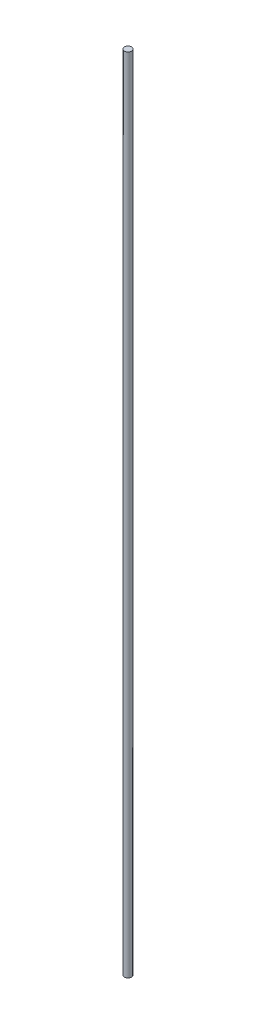
from build123d import *

# Parameters (mm, degrees)
SKETCH1_R           = 1.397
BOSS_EXTRUDE1_DEPTH = 304.8


with BuildPart() as part:
    # Sketch1 → Boss-Extrude1 (new body)
    with BuildSketch(Plane(origin=(0, 0, 0), x_dir=(1, 0, 0), z_dir=(0, 1, 0))):
        Circle(SKETCH1_R)
    extrude(amount=BOSS_EXTRUDE1_DEPTH)


solid = part.part
